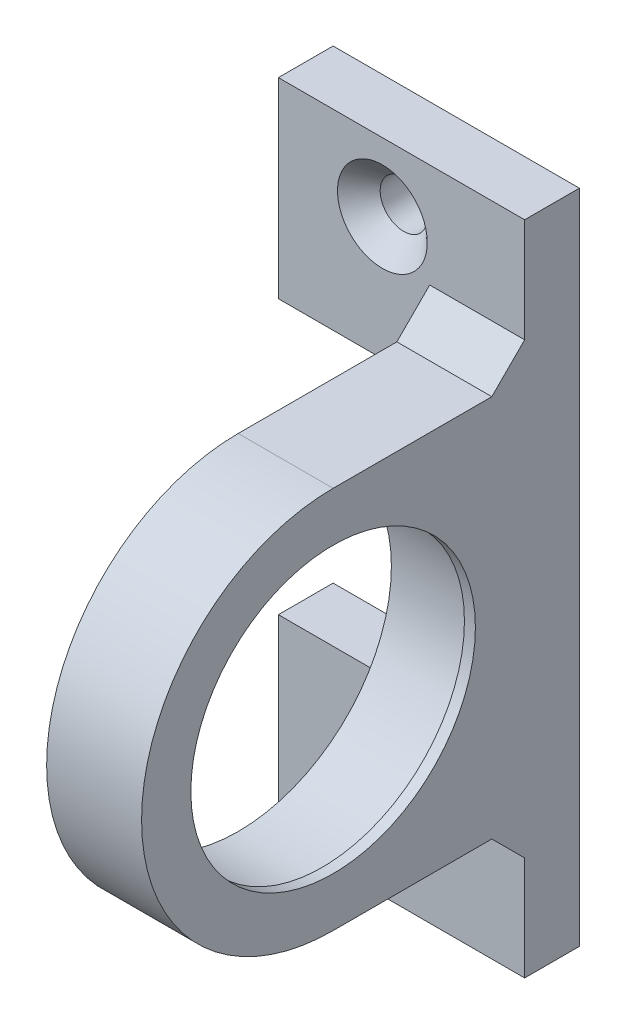
from build123d import *

# Parameters (mm, degrees)
SKETCH_2_W                     = 45
SKETCH_2_H                     = 60
SKETCH_2_W_2                   = 27.647058823
SKETCH_2_H_2                   = 25
EXTRUDE_2_DEPTH                = 5
SKETCH_4_W                     = 8.676470589
SKETCH_4_H                     = 35
SKETCH_4_W_2                   = 8.676470588
EXTRUDE_15_DEPTH               = 35
CUT_EXTRUDE_1_DEPTH            = 45
SKETCH_6_R                     = 14
CUT_EXTRUDE_2_DEPTH            = 45
FILLET_1_R                     = 5
SKETCH_7_R                     = 15
SKETCH_7_R_2                   = 13
EXTRUDE_16_DEPTH               = 1
SPLIT_BODIES_1_SURFACE_1_BACK  = 86
SPLIT_BODIES_1_SURFACE_1_DEPTH = 172
SPLIT_BODIES_1_SURFACE_2_BACK  = 86
SPLIT_BODIES_1_SURFACE_2_DEPTH = 172
HOLE_WIZARD_1_D                = 4.3
HOLE_WIZARD_1_DEPTH            = 5
HOLE_WIZARD_1_CSINK_D          = 8.2
HOLE_WIZARD_1_CSINK_ANGLE      = 90
HOLE_WIZARD_1_TIP              = 1.291850331
EXTRUDE_START                  = -1
SKETCH_14_R                    = 14
SKETCH_14_R_2                  = 13
EXTRUDE_1_DEPTH                = 1
CHAMFER_1_SIZE                 = 3


with BuildPart() as part:
    # 草图2 → 凸台-拉伸2 (new body)
    with BuildSketch(Plane.XY):
        with Locations((7.726423565, -5.661764706)):
            Rectangle(SKETCH_2_W, SKETCH_2_H)
        with Locations((7.726423565, -5.661764706)):
            Rectangle(SKETCH_2_W_2, SKETCH_2_H_2, mode=Mode.SUBTRACT)
    extrude(amount=EXTRUDE_2_DEPTH)

    # 草图4 → 凸台-拉伸15 (add)
    with BuildSketch(Plane.XY.offset(5)):
        with Locations((-10.435341141, -5.661764706)):
            Rectangle(SKETCH_4_W, SKETCH_4_H)
        with Locations((25.888188271, -5.661764706)):
            Rectangle(SKETCH_4_W_2, SKETCH_4_H)
    extrude(amount=EXTRUDE_15_DEPTH)

    # 草图5 → 切除-拉伸1 (cut)
    with BuildSketch(Plane.ZY.offset(14.773576435)):
        with BuildLine():
            ThreePointArc((22.5, 11.838235294), (34.874368671, 6.712603965), (40, -5.661764706))
            Line((40, -5.661764706), (40, 11.838235294))
            Line((40, 11.838235294), (22.5, 11.838235294))
        make_face()
        with BuildLine():
            Line((40, -23.161764706), (40, -5.661764706))
            ThreePointArc((40, -5.661764706), (34.874368671, -18.036133377), (22.5, -23.161764706))
            Line((22.5, -23.161764706), (40, -23.161764706))
        make_face()
    extrude(amount=-CUT_EXTRUDE_1_DEPTH, mode=Mode.SUBTRACT)

    # 草图6 → 切除-拉伸2 (cut)
    with BuildSketch(Plane.ZY.offset(14.773576435)):
        with Locations((22.5, -5.661764706)):
            Circle(SKETCH_6_R)
    extrude(amount=-CUT_EXTRUDE_2_DEPTH, mode=Mode.SUBTRACT)

    # 圆角1
    fillet_1_edges = [part.edges().sort_by_distance(p)[0] for p in [
        (-6.097105846, 6.838235294, 2.5),
        (21.549952977, 6.838235294, 2.5),
        (-6.097105846, -18.161764706, 2.5),
        (21.549952977, -18.161764706, 2.5),
    ]]
    fillet(fillet_1_edges, radius=FILLET_1_R)

    # 草图7 → 凸台-拉伸16 (add)
    with BuildSketch(Plane(origin=(-6.097105846, 0, 0), x_dir=(0, 0, -1), z_dir=(1, 0, 0))):
        with Locations((-22.5, -5.661764706)):
            Circle(SKETCH_7_R)
        with Locations((-22.5, -5.661764706)):
            Circle(SKETCH_7_R_2, mode=Mode.SUBTRACT)
    extrude(amount=-EXTRUDE_16_DEPTH)


with BuildPart() as body_2:
    # Split Bodies 1: the piece behind the surface
    add(part.part)
    # Split Bodies 1 surface: a surface, the sketch's curves swept straight by 172 mm
    with BuildLine(Plane.XY.offset(5).offset(-SPLIT_BODIES_1_SURFACE_1_BACK), mode=Mode.PRIVATE) as split_bodies_1_surface_1_path:
        Line((7.726423565, 24.338235294), (7.726423565, -35.661764706))
    split_bodies_1_surface_1 = Shell.extrude(split_bodies_1_surface_1_path.wire(), (0 * SPLIT_BODIES_1_SURFACE_1_DEPTH, 0 * SPLIT_BODIES_1_SURFACE_1_DEPTH, 1 * SPLIT_BODIES_1_SURFACE_1_DEPTH))
    split(bisect_by=split_bodies_1_surface_1, keep=Keep.BOTTOM)


with BuildPart() as part_1:
    add(part.part)

    # Split Bodies 1: split by a surface, the side it looks to stays
    # Split Bodies 1 surface: a surface, the sketch's curves swept straight by 172 mm
    with BuildLine(Plane.XY.offset(5).offset(-SPLIT_BODIES_1_SURFACE_2_BACK), mode=Mode.PRIVATE) as split_bodies_1_surface_2_path:
        Line((7.726423565, 24.338235294), (7.726423565, -35.661764706))
    split_bodies_1_surface_2 = Shell.extrude(split_bodies_1_surface_2_path.wire(), (0 * SPLIT_BODIES_1_SURFACE_2_DEPTH, 0 * SPLIT_BODIES_1_SURFACE_2_DEPTH, 1 * SPLIT_BODIES_1_SURFACE_2_DEPTH))
    split(bisect_by=split_bodies_1_surface_2, keep=Keep.TOP)

    # 打孔尺寸(%根据)内六角花形半沉头螺钉的类型1
    with Locations(Plane(origin=(17.226423565, 18.088235294, 5), x_dir=(1, 0, 0), z_dir=(0, 0, 1))):
        with Locations((0, 0), (0, -47.5)):
            CounterSinkHole(HOLE_WIZARD_1_D / 2, HOLE_WIZARD_1_CSINK_D / 2, depth=HOLE_WIZARD_1_DEPTH, counter_sink_angle=HOLE_WIZARD_1_CSINK_ANGLE)
            with Locations((0, 0, -(HOLE_WIZARD_1_DEPTH + HOLE_WIZARD_1_TIP / 2))):  # 118° drill point
                Cone(0, HOLE_WIZARD_1_D / 2, HOLE_WIZARD_1_TIP, mode=Mode.SUBTRACT)

    # 草图14 → 拉伸-薄壁1 (add)
    with BuildSketch(Plane(origin=(30.226423565, 0, 0), x_dir=(0, 0, -1), z_dir=(1, 0, 0)).offset(EXTRUDE_START)):
        with Locations((-22.5, -5.661764706)):
            Circle(SKETCH_14_R)
        with Locations((-22.5, -5.661764706)):
            Circle(SKETCH_14_R_2, mode=Mode.SUBTRACT)
    extrude(amount=EXTRUDE_1_DEPTH)

    # 倒角1
    chamfer_1_edges = [part_1.edges().sort_by_distance(p)[0] for p in [
        (25.888188271, -23.161764706, 5),
        (25.888188271, 11.838235294, 5),
    ]]
    chamfer(chamfer_1_edges, length=CHAMFER_1_SIZE)


solid = part_1.part
